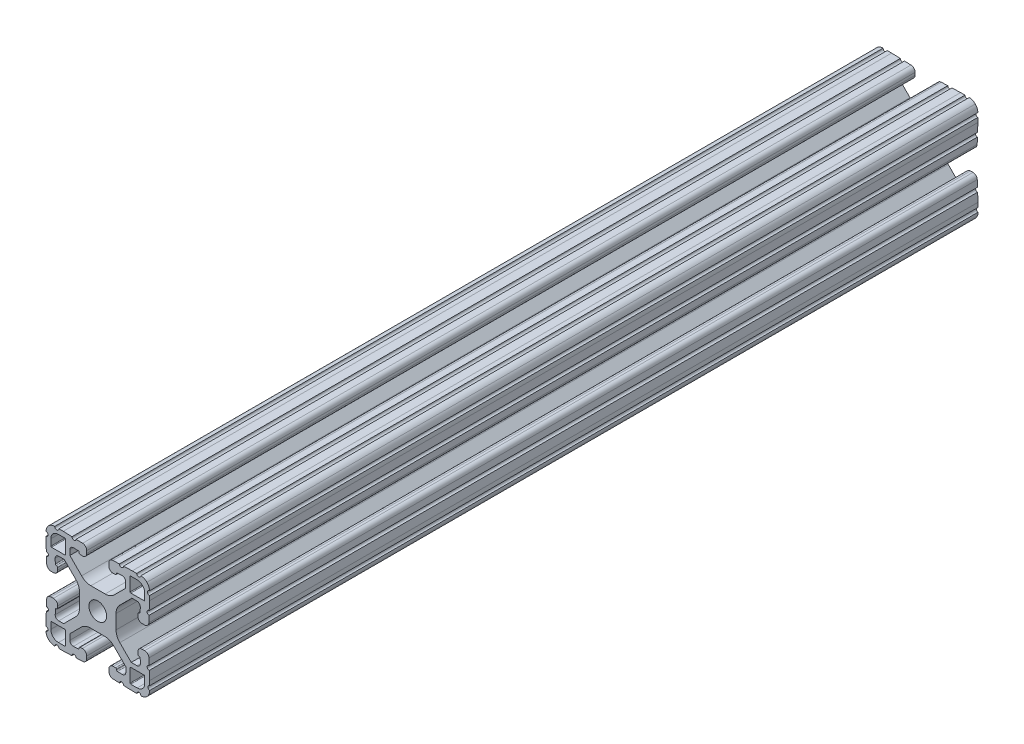
from build123d import *

# Parameters (mm, degrees)
SKETCH1_R           = 3.2639
BOSS_EXTRUDE1_DEPTH = 304.8


with BuildPart() as part:
    # Sketch1 → Boss-Extrude1 (new body)
    with BuildSketch(Plane(origin=(0, 0, -25.4), x_dir=(-1, 0, 0), z_dir=(0, 0, -1))):
        with BuildLine():
            Line((-88.043721549, 91.862643967), (-86.29674679, 91.923648859))
            ThreePointArc((-86.29674679, 91.923648859), (-85.370208675, 91.567983831), (-84.982425017, 90.654422489))
            Line((-84.982425017, 90.654422489), (-84.982425017, 88.800173916))
            Line((-84.982425017, 88.800173916), (-89.306565884, 84.476033049))
            ThreePointArc((-89.306565884, 84.476033049), (-90.866149908, 83.406077005), (-92.719610366, 83.029523439))
            Line((-92.719610366, 83.029523439), (-97.961628589, 83.029523439))
            ThreePointArc((-97.961628589, 83.029523439), (-99.779298356, 83.391080435), (-101.320244378, 84.42070765))
            Line((-101.320244378, 84.42070765), (-105.516001761, 88.616465033))
            Line((-105.516001761, 88.616465033), (-105.516001761, 90.731330035))
            ThreePointArc((-105.516001761, 90.731330035), (-105.128218103, 91.644891377), (-104.201679988, 92.000556406))
            Line((-104.201679988, 92.000556406), (-102.454705229, 91.939551513))
            ThreePointArc((-102.454705229, 91.939551513), (-102.193933359, 91.823448504), (-102.087001761, 91.558783602))
            ThreePointArc((-102.087001761, 91.558783602), (-102.010859042, 91.249291513), (-101.726191901, 91.105946874))
            Line((-101.726191901, 91.105946874), (-100.929727576, 91.078102142))
            ThreePointArc((-100.929727576, 91.078102142), (-99.780779944, 91.519102656), (-99.299905511, 92.651940638))
            Line((-99.299905511, 92.651940638), (-99.299905511, 93.566848638))
            ThreePointArc((-99.299905511, 93.566848638), (-99.741889517, 94.660796975), (-100.819746715, 95.140689345))
            Line((-100.819746715, 95.140689345), (-103.211918901, 95.224224422))
            ThreePointArc((-103.211918901, 95.224224422), (-104.000045777, 94.489281495), (-104.734990687, 95.277406522))
            Line((-104.734990687, 95.277406522), (-107.935905676, 95.389166912))
            Line((-107.935905676, 95.389166912), (-109.561454876, 95.389166912))
            ThreePointArc((-109.561454876, 95.389166912), (-110.323454876, 94.627166912), (-111.085454876, 95.389166912))
            ThreePointArc((-111.085454876, 95.389166912), (-112.308767787, 95.144035599), (-113.343184761, 94.446493225))
            ThreePointArc((-113.343184761, 94.446493225), (-114.04072548, 93.412075135), (-114.285854836, 92.188761832))
            ThreePointArc((-114.285854836, 92.188761832), (-113.523853616, 91.426762441), (-114.285853616, 90.664761832))
            Line((-114.285853616, 90.664761832), (-114.285853616, 89.039212632))
            Line((-114.285853616, 89.039212632), (-114.174093219, 85.838297643))
            ThreePointArc((-114.174093219, 85.838297643), (-113.385968191, 85.103352735), (-114.120911115, 84.315225857))
            Line((-114.120911115, 84.315225857), (-114.037376031, 81.923053667))
            ThreePointArc((-114.037376031, 81.923053667), (-113.55748366, 80.845196472), (-112.463535325, 80.403212468))
            Line((-112.463535325, 80.403212468), (-111.548627325, 80.403212468))
            ThreePointArc((-111.548627325, 80.403212468), (-110.415788905, 80.884087354), (-109.974788872, 82.033035791))
            Line((-109.974788872, 82.033035791), (-110.002634241, 82.829500094))
            ThreePointArc((-110.002634241, 82.829500094), (-110.118742417, 83.090261917), (-110.383401914, 83.197188))
            ThreePointArc((-110.383401914, 83.197188), (-110.693757401, 83.272605688), (-110.837665276, 83.557735272))
            Line((-110.837665276, 83.557735272), (-110.898671566, 85.304709982))
            ThreePointArc((-110.898671566, 85.304709982), (-110.543006925, 86.231248747), (-109.62944523, 86.61903277))
            Line((-109.62944523, 86.61903277), (-107.807161806, 86.61903277))
            Line((-107.807161806, 86.61903277), (-103.364925613, 82.176810793))
            ThreePointArc((-103.364925613, 82.176810793), (-102.335294479, 80.635862907), (-101.973736029, 78.81818963))
            Line((-101.973736029, 78.81818963), (-101.973736029, 73.576034207))
            ThreePointArc((-101.973736029, 73.576034207), (-102.335293752, 71.758362684), (-103.364922926, 70.21741573))
            Line((-103.364922926, 70.21741573), (-107.560683666, 66.021661704))
            Line((-107.560683666, 66.021661704), (-109.652436558, 66.021661704))
            ThreePointArc((-109.652436558, 66.021661704), (-110.565998503, 66.409445617), (-110.921663765, 67.335984343))
            Line((-110.921663765, 67.335984343), (-110.860658873, 69.082959102))
            ThreePointArc((-110.860658873, 69.082959102), (-110.744555864, 69.343730973), (-110.479890961, 69.45066257))
            ThreePointArc((-110.479890961, 69.45066257), (-110.173494703, 69.529390272), (-110.032185196, 69.812424443))
            Line((-110.032185196, 69.812424443), (-110.004340464, 70.608888768))
            ThreePointArc((-110.004340464, 70.608888768), (-110.445340978, 71.7578364), (-111.57817896, 72.238710833))
            Line((-111.57817896, 72.238710833), (-112.49308696, 72.238710833))
            ThreePointArc((-112.49308696, 72.238710833), (-113.587035297, 71.796726827), (-114.066927667, 70.718869629))
            Line((-114.066927667, 70.718869629), (-114.150462744, 68.326697443))
            ThreePointArc((-114.150462744, 68.326697443), (-113.415519817, 67.538570567), (-114.203644843, 66.803625657))
            Line((-114.203644843, 66.803625657), (-114.315405233, 63.602710668))
            Line((-114.315405233, 63.602710668), (-114.315405233, 61.962557497))
            ThreePointArc((-114.315405233, 61.962557497), (-113.701927281, 61.206106537), (-114.333208228, 60.464447842))
            ThreePointArc((-114.333208228, 60.464447842), (-114.113020459, 59.176546471), (-113.392816136, 58.086372941))
            ThreePointArc((-113.392816136, 58.086372941), (-112.358398046, 57.388832223), (-111.135084743, 57.143702867))
            ThreePointArc((-111.135084743, 57.143702867), (-110.373085352, 57.905704086), (-109.611084743, 57.143704086))
            Line((-109.611084743, 57.143704086), (-107.985535543, 57.143704086))
            Line((-107.985535543, 57.143704086), (-104.784620554, 57.255464483))
            ThreePointArc((-104.784620554, 57.255464483), (-104.049675645, 58.04358951), (-103.261548768, 57.308646586))
            Line((-103.261548768, 57.308646586), (-100.869376578, 57.39218167))
            ThreePointArc((-100.869376578, 57.39218167), (-99.791519383, 57.872074041), (-99.349535378, 58.966022376))
            Line((-99.349535378, 58.966022376), (-99.349535378, 59.880930376))
            ThreePointArc((-99.349535378, 59.880930376), (-99.830409811, 61.013768358), (-100.979357443, 61.454768873))
            Line((-100.979357443, 61.454768873), (-101.775821768, 61.42692414))
            ThreePointArc((-101.775821768, 61.42692414), (-102.036583684, 61.310816174), (-102.143509978, 61.046156762))
            ThreePointArc((-102.143509978, 61.046156762), (-102.222494916, 60.740061862), (-102.505377386, 60.598958297))
            Line((-102.505377386, 60.598958297), (-104.252352145, 60.537953405))
            ThreePointArc((-104.252352145, 60.537953405), (-105.17889026, 60.893618433), (-105.566673918, 61.807179775))
            Line((-105.566673918, 61.807179775), (-105.566673918, 63.629462758))
            Line((-105.566673918, 63.629462758), (-101.131142468, 68.064994208))
            ThreePointArc((-101.131142468, 68.064994208), (-99.590196446, 69.094621422), (-97.772526678, 69.456178419))
            Line((-97.772526678, 69.456178419), (-92.530356056, 69.456178419))
            ThreePointArc((-92.530356056, 69.456178419), (-90.712686289, 69.094621422), (-89.171740267, 68.064994208))
            Line((-89.171740267, 68.064994208), (-84.975982884, 63.869236825))
            Line((-84.975982884, 63.869236825), (-84.975982884, 61.781050107))
            ThreePointArc((-84.975982884, 61.781050107), (-85.363766542, 60.867488765), (-86.290304657, 60.511823736))
            Line((-86.290304657, 60.511823736), (-88.037279416, 60.572828629))
            ThreePointArc((-88.037279416, 60.572828629), (-88.298051286, 60.688931638), (-88.404982884, 60.95359654))
            ThreePointArc((-88.404982884, 60.95359654), (-88.466593694, 61.278962759), (-88.759626911, 61.433204782))
            Line((-88.759626911, 61.433204782), (-89.556091237, 61.461049514))
            ThreePointArc((-89.556091237, 61.461049514), (-90.705038868, 61.020049), (-91.185913301, 59.887211018))
            Line((-91.185913301, 59.887211018), (-91.185913301, 58.972303018))
            ThreePointArc((-91.185913301, 58.972303018), (-90.743929295, 57.878354681), (-89.666072098, 57.398462311))
            Line((-89.666072098, 57.398462311), (-87.273899911, 57.314927234))
            ThreePointArc((-87.273899911, 57.314927234), (-86.485773036, 58.049870161), (-85.750828126, 57.261745135))
            Line((-85.750828126, 57.261745135), (-82.549913136, 57.149984745))
            Line((-82.549913136, 57.149984745), (-80.924363936, 57.149984745))
            ThreePointArc((-80.924363936, 57.149984745), (-80.162363936, 57.911984745), (-79.400363936, 57.149984745))
            ThreePointArc((-79.400363936, 57.149984745), (-78.177051025, 57.395116058), (-77.142634052, 58.092658432))
            ThreePointArc((-77.142634052, 58.092658432), (-76.445094372, 59.127074031), (-76.199963977, 60.350384428))
            ThreePointArc((-76.199963977, 60.350384428), (-76.961961268, 61.112385783), (-76.199961268, 61.874384428))
            Line((-76.199961268, 61.874384428), (-76.199961268, 63.499933628))
            Line((-76.199961268, 63.499933628), (-76.311721666, 66.700848617))
            ThreePointArc((-76.311721666, 66.700848617), (-77.099846694, 67.435793525), (-76.364903769, 68.223920403))
            Line((-76.364903769, 68.223920403), (-76.448438853, 70.616092593))
            ThreePointArc((-76.448438853, 70.616092593), (-76.928331225, 71.693949788), (-78.02227956, 72.135933792))
            Line((-78.02227956, 72.135933792), (-78.93718756, 72.135933792))
            ThreePointArc((-78.93718756, 72.135933792), (-80.07002598, 71.655058906), (-80.511026012, 70.506110469))
            Line((-80.511026012, 70.506110469), (-80.483180643, 69.709646166))
            ThreePointArc((-80.483180643, 69.709646166), (-80.367072468, 69.448884343), (-80.102412971, 69.34195826))
            ThreePointArc((-80.102412971, 69.34195826), (-79.796317908, 69.262973649), (-79.655214052, 68.980091239))
            Line((-79.655214052, 68.980091239), (-79.594207761, 67.233116529))
            ThreePointArc((-79.594207761, 67.233116529), (-79.949872402, 66.306577764), (-80.863434097, 65.918793741))
            Line((-80.863434097, 65.918793741), (-82.685717521, 65.918793741))
            Line((-82.685717521, 65.918793741), (-87.121258001, 70.35431293))
            ThreePointArc((-87.121258001, 70.35431293), (-88.150863946, 71.895196205), (-88.512450271, 73.712794894))
            Line((-88.512450271, 73.712794894), (-88.512606864, 78.954950317))
            ThreePointArc((-88.512606864, 78.954950317), (-88.151076291, 80.772698182), (-87.121419968, 82.313710679))
            Line((-87.121419968, 82.313710679), (-82.925659228, 86.509464706))
            Line((-82.925659228, 86.509464706), (-80.837473527, 86.509464706))
            ThreePointArc((-80.837473527, 86.509464706), (-79.923911584, 86.121680793), (-79.568246321, 85.195142068))
            Line((-79.568246321, 85.195142068), (-79.629251214, 83.448167309))
            ThreePointArc((-79.629251214, 83.448167309), (-79.745354223, 83.187395438), (-80.010019125, 83.080463841))
            ThreePointArc((-80.010019125, 83.080463841), (-80.335385344, 83.018853031), (-80.489627367, 82.725819813))
            Line((-80.489627367, 82.725819813), (-80.5174721, 81.929355488))
            ThreePointArc((-80.5174721, 81.929355488), (-80.076471586, 80.780407856), (-78.943633603, 80.299533423))
            Line((-78.943633603, 80.299533423), (-78.028725603, 80.299533423))
            ThreePointArc((-78.028725603, 80.299533423), (-76.934777267, 80.741517429), (-76.454884897, 81.819374627))
            Line((-76.454884897, 81.819374627), (-76.37134982, 84.211546813))
            ThreePointArc((-76.37134982, 84.211546813), (-77.106292747, 84.999673689), (-76.31816772, 85.734618599))
            Line((-76.31816772, 85.734618599), (-76.20640733, 88.935533588))
            Line((-76.20640733, 88.935533588), (-76.20640733, 90.561082788))
            ThreePointArc((-76.20640733, 90.561082788), (-76.96840733, 91.323083398), (-76.206406111, 92.085082788))
            ThreePointArc((-76.206406111, 92.085082788), (-76.451535467, 93.308396091), (-77.149076185, 94.342814181))
            ThreePointArc((-77.149076185, 94.342814181), (-78.183493159, 95.040356555), (-79.40680607, 95.285487868))
            ThreePointArc((-79.40680607, 95.285487868), (-80.16880607, 94.523487868), (-80.93080607, 95.285487868))
            Line((-80.93080607, 95.285487868), (-82.55635527, 95.285487868))
            Line((-82.55635527, 95.285487868), (-85.757270259, 95.173727471))
            ThreePointArc((-85.757270259, 95.173727471), (-86.492215168, 94.385602444), (-87.280342045, 95.120545368))
            Line((-87.280342045, 95.120545368), (-89.672514235, 95.037010285))
            ThreePointArc((-89.672514235, 95.037010285), (-90.75037143, 94.557117913), (-91.192355435, 93.463169578))
            Line((-91.192355435, 93.463169578), (-91.192355435, 92.548261578))
            ThreePointArc((-91.192355435, 92.548261578), (-90.711481002, 91.415423596), (-89.56253337, 90.974423082))
            Line((-89.56253337, 90.974423082), (-88.766069045, 91.002267814))
            ThreePointArc((-88.766069045, 91.002267814), (-88.505307129, 91.11837578), (-88.398380835, 91.383035192))
            ThreePointArc((-88.398380835, 91.383035192), (-88.336765486, 91.708407548), (-88.043721549, 91.862643967))
        make_face()
        with Locations((-95.25, 76.2)):
            Circle(SKETCH1_R, mode=Mode.SUBTRACT)
        with BuildLine():
            Line((-83.357745393, 88.294108398), (-83.357745393, 93.170908398))
            ThreePointArc((-83.357745393, 93.170908398), (-83.283351492, 93.350512545), (-83.103748154, 93.424908398))
            Line((-83.103748154, 93.424908398), (-80.766975763, 93.424933798))
            ThreePointArc((-80.766975763, 93.424933798), (-78.791299784, 92.606600882), (-77.972945393, 90.630933798))
            Line((-77.972945393, 90.630933798), (-77.972945393, 88.294108398))
            ThreePointArc((-77.972945393, 88.294108398), (-78.047340271, 88.114503276), (-78.226945393, 88.040108398))
            Line((-78.226945393, 88.040108398), (-83.103745393, 88.040108398))
            ThreePointArc((-83.103745393, 88.040108398), (-83.283350516, 88.114503276), (-83.357745393, 88.294108398))
        make_face(mode=Mode.SUBTRACT)
        with BuildLine():
            Line((-83.357745393, 59.229091602), (-83.357745393, 64.105891602))
            ThreePointArc((-83.357745393, 64.105891602), (-83.283350516, 64.285496724), (-83.103745393, 64.359891602))
            Line((-83.103745393, 64.359891602), (-78.226945393, 64.359891602))
            ThreePointArc((-78.226945393, 64.359891602), (-78.047340271, 64.285496724), (-77.972945393, 64.105891602))
            Line((-77.972945393, 64.105891602), (-77.972945393, 61.769066202))
            ThreePointArc((-77.972945393, 61.769066202), (-78.791299784, 59.793399118), (-80.766975763, 58.975066202))
            Line((-80.766975763, 58.975066202), (-83.103748154, 58.975091602))
            ThreePointArc((-83.103748154, 58.975091602), (-83.283351492, 59.049487455), (-83.357745393, 59.229091602))
        make_face(mode=Mode.SUBTRACT)
        with BuildLine():
            Line((-107.142254607, 93.170908398), (-107.142254607, 88.294108398))
            ThreePointArc((-107.142254607, 88.294108398), (-107.216649484, 88.114503276), (-107.396254607, 88.040108398))
            Line((-107.396254607, 88.040108398), (-112.273054607, 88.040108398))
            ThreePointArc((-112.273054607, 88.040108398), (-112.452659729, 88.114503276), (-112.527054607, 88.294108398))
            Line((-112.527054607, 88.294108398), (-112.527054607, 90.630933798))
            ThreePointArc((-112.527054607, 90.630933798), (-111.708700216, 92.606600882), (-109.733024237, 93.424933798))
            Line((-109.733024237, 93.424933798), (-107.396251846, 93.424908398))
            ThreePointArc((-107.396251846, 93.424908398), (-107.216648508, 93.350512545), (-107.142254607, 93.170908398))
        make_face(mode=Mode.SUBTRACT)
        with BuildLine():
            Line((-107.142254607, 64.105891602), (-107.142254607, 59.229091602))
            ThreePointArc((-107.142254607, 59.229091602), (-107.216648508, 59.049487455), (-107.396251846, 58.975091602))
            Line((-107.396251846, 58.975091602), (-109.733024237, 58.975066202))
            ThreePointArc((-109.733024237, 58.975066202), (-111.708700216, 59.793399118), (-112.527054607, 61.769066202))
            Line((-112.527054607, 61.769066202), (-112.527054607, 64.105891602))
            ThreePointArc((-112.527054607, 64.105891602), (-112.452659729, 64.285496724), (-112.273054607, 64.359891602))
            Line((-112.273054607, 64.359891602), (-107.396254607, 64.359891602))
            ThreePointArc((-107.396254607, 64.359891602), (-107.216649484, 64.285496724), (-107.142254607, 64.105891602))
        make_face(mode=Mode.SUBTRACT)
    extrude(amount=-BOSS_EXTRUDE1_DEPTH)


solid = part.part
